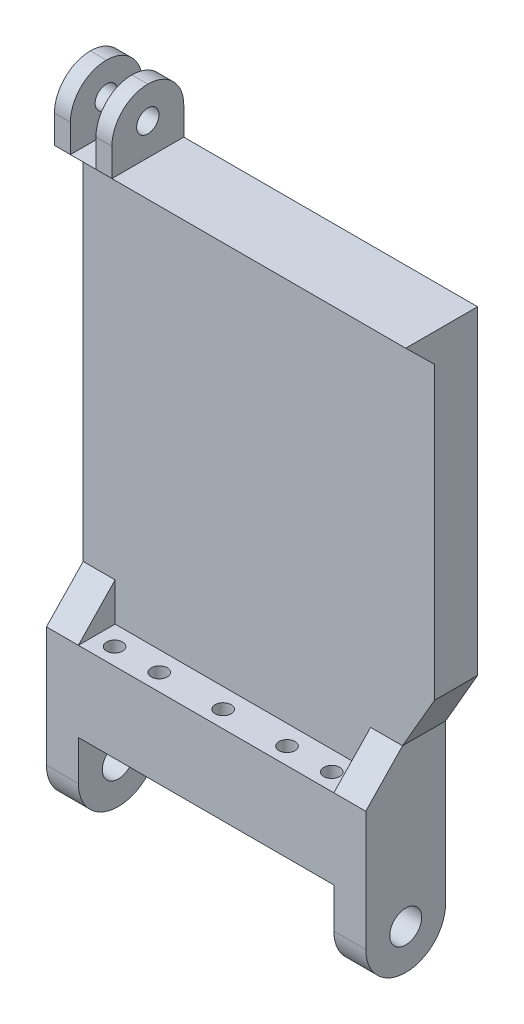
from build123d import *

# Parameters (mm, degrees)
SKETCH1_W               = 50
SKETCH1_H               = 12.5
SKETCH1_W_2             = 5
BOSS_EXTRUDE1_DEPTH     = 12.5
FILLET1_R               = 6.25
CUT_EXTRUDE1_DEPTH      = 77.5
CUT_EXTRUDE1_DEPTH_BACK = 24.5
SKETCH2_R               = 2.5
SKETCH4_R               = 1.25
CUT_EXTRUDE2_DEPTH      = 12.5
BOSS_EXTRUDE4_DEPTH     = 6
BOSS_EXTRUDE5_DEPTH     = 5
BOSS_EXTRUDE6_DEPTH     = 5
BOSS_EXTRUDE8_DEPTH     = 6.75
BOSS_EXTRUDE10_DEPTH    = 55
SKETCH12_W              = 2.5
SKETCH12_H              = 10
BOSS_EXTRUDE11_DEPTH    = 11.25
SKETCH14_W              = 2.5
SKETCH14_H              = 10
BOSS_EXTRUDE12_DEPTH    = 11.25
FILLET2_R               = 5.625
SKETCH16_R              = 1.75
CUT_EXTRUDE3_DEPTH      = 18.25


with BuildPart() as part:
    # Sketch1 → Boss-Extrude1 (new body)
    with BuildSketch(Plane.XY):
        with Locations((25, -6.25)):
            Rectangle(SKETCH1_W, SKETCH1_H)
        with Locations((2.5, -18.75)):
            Rectangle(SKETCH1_W_2, SKETCH1_H)
        with Locations((47.5, -18.75)):
            Rectangle(SKETCH1_W_2, SKETCH1_H)
    extrude(amount=BOSS_EXTRUDE1_DEPTH)

    # Fillet1
    fillet1_edges = [part.edges().sort_by_distance(p)[0] for p in [
        (2.5, -25, 12.5),
        (2.5, -25, 0),
        (47.5, -25, 12.5),
        (47.5, -25, 0),
    ]]
    fillet(fillet1_edges, radius=FILLET1_R - 0.0001)  # a hair under: the kernel refuses the full size

    # Sketch2 → Cut-Extrude1 (cut, two sides: drawn at the far end of the back side and taken through both)
    with BuildSketch(Plane(origin=(5, 0, 0), x_dir=(0, 0, -1), z_dir=(1, 0, 0)).offset(-CUT_EXTRUDE1_DEPTH_BACK)):
        with Locations((-6.25, -18.75)):
            Circle(SKETCH2_R)
    extrude(amount=CUT_EXTRUDE1_DEPTH + CUT_EXTRUDE1_DEPTH_BACK, mode=Mode.SUBTRACT)

    # Sketch4 → Cut-Extrude2 (cut)
    with BuildSketch(Plane(origin=(0, -12.5, 0), x_dir=(-1, 0, 0), z_dir=(0, -1, 0))):
        with Locations(Location((-8, -9.835613506, 0), (0, 0, 90))):
            Circle(SKETCH4_R)
        with Locations(Location((-15, -9.835613506, 0), (0, 0, 90))):
            Circle(SKETCH4_R)
        with Locations(Location((-25, -9.835613506, 0), (0, 0, 90))):
            Circle(SKETCH4_R)
        with Locations(Location((-35, -9.835613506, 0), (0, 0, 90))):
            Circle(SKETCH4_R)
        with Locations(Location((-42, -9.835613506, 0), (0, 0, 90))):
            Circle(SKETCH4_R)
    extrude(amount=-CUT_EXTRUDE2_DEPTH, mode=Mode.SUBTRACT)

    # Sketch5 → Boss-Extrude4 (add)
    with BuildSketch(Plane(origin=(0, 0, 0), x_dir=(1, 0, 0), z_dir=(0, 1, 0))):
        Polygon((50, 0), (0, 0), (0, -6.75), (5.75, -6.75), (44.25, -6.75), (50, -6.75), align=None)
    extrude(amount=BOSS_EXTRUDE4_DEPTH)

    # Sketch6 → Boss-Extrude5 (add)
    with BuildSketch(Plane.ZY):
        Polygon((6.75, 6), (12.5, 0), (6.75, 0), align=None)
    extrude(amount=-BOSS_EXTRUDE5_DEPTH)

    # Sketch7 → Boss-Extrude6 (add)
    with BuildSketch(Plane(origin=(50, 0, 0), x_dir=(0, 0, -1), z_dir=(1, 0, 0))):
        Polygon((-6.75, 6), (-12.5, 0), (-6.75, 0), align=None)
    extrude(amount=-BOSS_EXTRUDE6_DEPTH)

    # Sketch8 → Boss-Extrude8 (add)
    with BuildSketch(Plane(origin=(0, 0, 0), x_dir=(-1, 0, 0), z_dir=(0, 0, -1))):
        Polygon((-50, 6), (-55, 14.660254038), (-55, 64.660254038), (0, 64.660254038), (0, 6), align=None)
    extrude(amount=-BOSS_EXTRUDE8_DEPTH)

    # Sketch10 → Boss-Extrude10 (add)
    with BuildSketch(Plane.ZY):
        Polygon((6.75, 64.660254038), (11.25, 64.660254038), (6.75, 60.225702909), align=None)
    extrude(amount=-BOSS_EXTRUDE10_DEPTH)

    # Sketch12 → Boss-Extrude11 (add)
    with BuildSketch(Plane(origin=(0, 0, 0), x_dir=(-1, 0, 0), z_dir=(0, 0, -1))):
        with Locations((-1.25, 69.660254038)):
            Rectangle(SKETCH12_W, SKETCH12_H)
    extrude(amount=-BOSS_EXTRUDE11_DEPTH)

    # Sketch14 → Boss-Extrude12 (add)
    with BuildSketch(Plane(origin=(0, 0, 0), x_dir=(-1, 0, 0), z_dir=(0, 0, -1))):
        with Locations((-7.75, 69.660254038)):
            Rectangle(SKETCH14_W, SKETCH14_H)
    extrude(amount=-BOSS_EXTRUDE12_DEPTH)

    # Fillet2
    fillet2_edges = [part.edges().sort_by_distance(p)[0] for p in [
        (7.75, 74.660254038, 0),
        (7.75, 74.660254038, 11.25),
        (1.25, 74.660254038, 11.25),
        (1.25, 74.660254038, 0),
    ]]
    fillet(fillet2_edges, radius=FILLET2_R - 0.0001)  # a hair under: the kernel refuses the full size

    # Sketch16 → Cut-Extrude3 (cut)
    with BuildSketch(Plane(origin=(9, 0, 0), x_dir=(0, 0, -1), z_dir=(1, 0, 0))):
        with Locations(Location((-5.625, 69.660254038, 0), (0, 0, 90))):
            Circle(SKETCH16_R)
    extrude(amount=-CUT_EXTRUDE3_DEPTH, mode=Mode.SUBTRACT)


solid = part.part
